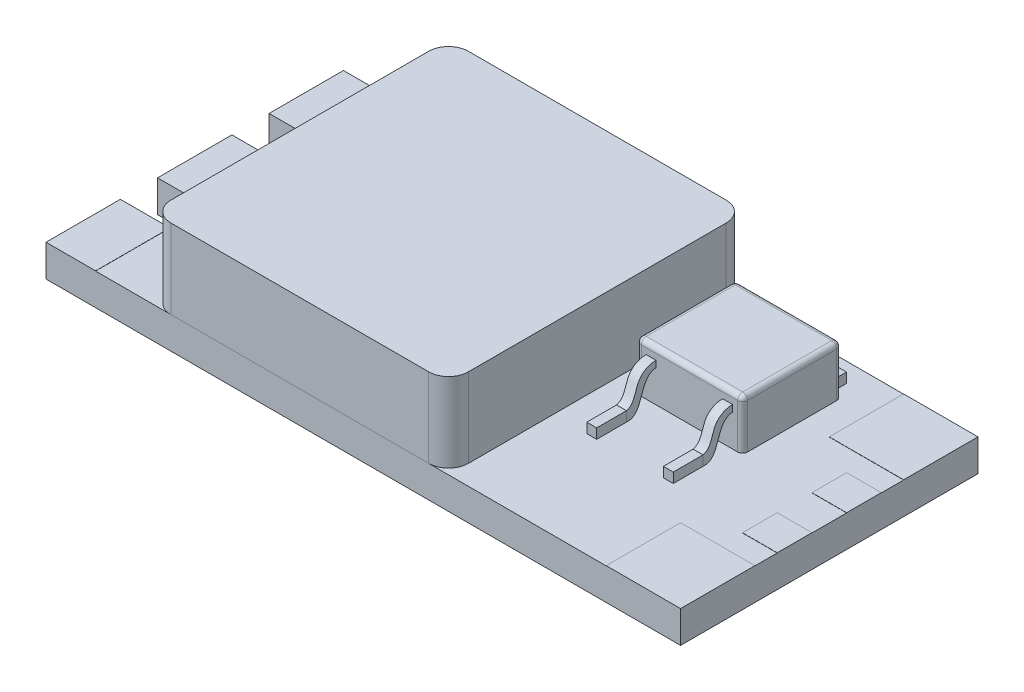
from build123d import *

# Parameters (mm, degrees)
BOSS_EXTRUDE1_DEPTH   = 1.6
SKETCH2_W             = 15
SKETCH2_H             = 15
BOSS_EXTRUDE2_DEPTH   = 4
FILLET1_R             = 1
SKETCH3_W             = 2.5
SKETCH3_H             = 3.75
SKETCH3_W_2           = 3.75
SKETCH3_W_3           = 1.75
SKETCH3_H_2           = 1.75
BOSS_EXTRUDE3_DEPTH   = 0.01
SKETCH4_W             = 5.361600472
SKETCH4_H             = 4.987535322
BOSS_EXTRUDE4_DEPTH   = 2.5
SKETCH6_W             = 4.361600472
SKETCH6_H             = 0.75
BOSS_EXTRUDE5_DEPTH   = 0.5
SKETCH6_W_2           = 0.5
SKETCH6_H_2           = 1.5
BOSS_EXTRUDE5_2_DEPTH = 0.5
BOSS_EXTRUDE5_3_DEPTH = 0.5
BOSS_EXTRUDE6_DEPTH   = 0.5
BOSS_EXTRUDE7_DEPTH   = 0.5
FILLET2_R             = 0.25
FILLET3_R             = 0.25


with BuildPart() as part:
    # Sketch1 → Boss-Extrude1 (new body)
    with BuildSketch(Plane(origin=(0, 0, 0), x_dir=(1, 0, 0), z_dir=(0, 1, 0))):
        Polygon((2.5, 3.75), (0, 3.75), (0, 0), (2.5, 0), (32, 0), (32, 15), (2.5, 15), (0, 15), (0, 11.25), (2.5, 11.25), (2.5, 9.375), (0, 9.375), (0, 5.625), (2.5, 5.625), align=None)
    extrude(amount=BOSS_EXTRUDE1_DEPTH)

    # Sketch3 → Boss-Extrude3 (add)
    with BuildSketch(Plane(origin=(0, 1.6, 0), x_dir=(1, 0, 0), z_dir=(0, 1, 0))):
        with Locations((1.25, 13.125)):
            Rectangle(SKETCH3_W, SKETCH3_H)
        with Locations((30.125, 13.125)):
            Rectangle(SKETCH3_W_2, SKETCH3_H)
        with Locations((1.25, 7.5)):
            Rectangle(SKETCH3_W, SKETCH3_H)
        with Locations((1.25, 1.875)):
            Rectangle(SKETCH3_W, SKETCH3_H)
        with Locations((31.125, 9.25)):
            Rectangle(SKETCH3_W_3, SKETCH3_H_2)
        with Locations((30.125, 1.875)):
            Rectangle(SKETCH3_W_2, SKETCH3_H)
        with Locations((31.125, 5.75)):
            Rectangle(SKETCH3_W_3, SKETCH3_H_2)
    extrude(amount=BOSS_EXTRUDE3_DEPTH)

    # Sketch4 → Boss-Extrude4 (add)
    with BuildSketch(Plane(origin=(0, 1.6, 0), x_dir=(1, 0, 0), z_dir=(0, 1, 0))):
        with Locations((24.163228826, 10.781587961)):
            Rectangle(SKETCH4_W, SKETCH4_H)
    extrude(amount=BOSS_EXTRUDE4_DEPTH)

    # Fillet2
    fillet2_edges = [part.edges().sort_by_distance(p)[0] for p in [
        (21.48242859, 2.85, -13.275355622),
        (21.48242859, 2.85, -8.2878203),
        (26.844029062, 2.85, -8.2878203),
        (26.844029062, 2.85, -13.275355622),
    ]]
    fillet(fillet2_edges, radius=FILLET2_R)

    # Fillet3
    fillet3_edges = [part.edges().sort_by_distance(p)[0] for p in [
        (26.770805757, 4.1, -13.202132318),
        (26.844029062, 4.1, -10.781587961),
        (26.770805757, 4.1, -8.361043604),
        (24.163228826, 4.1, -8.2878203),
        (21.555651895, 4.1, -8.361043604),
        (21.48242859, 4.1, -10.781587961),
        (21.555651895, 4.1, -13.202132318),
        (24.163228826, 4.1, -13.275355622),
    ]]
    fillet(fillet3_edges, radius=FILLET3_R)


with BuildPart() as body_2:
    # Sketch2 → Boss-Extrude2 (new body)
    with BuildSketch(Plane(origin=(0, 1.6, 0), x_dir=(1, 0, 0), z_dir=(0, 1, 0))):
        with Locations((12.8, 7.5)):
            Rectangle(SKETCH2_W, SKETCH2_H)
    extrude(amount=BOSS_EXTRUDE2_DEPTH)

    # Fillet1
    fillet1_edges = [body_2.edges().sort_by_distance(p)[0] for p in [
        (20.3, 3.6, 0),
        (20.3, 3.6, -15),
        (5.3, 3.6, -15),
        (5.3, 3.6, 0),
    ]]
    fillet(fillet1_edges, radius=FILLET1_R)


with BuildPart() as body_3:
    # Sketch6 → Boss-Extrude5 (new body)
    with BuildSketch(Plane(origin=(0, 1.6, 0), x_dir=(1, 0, 0), z_dir=(0, 1, 0))):
        with Locations((24.163228826, 13.650355622)):
            Rectangle(SKETCH6_W, SKETCH6_H)
    extrude(amount=BOSS_EXTRUDE5_DEPTH)


with BuildPart() as body_4:
    # Sketch6 → Boss-Extrude5 2 (new body)
    with BuildSketch(Plane(origin=(0, 1.6, 0), x_dir=(1, 0, 0), z_dir=(0, 1, 0))):
        with Locations((22.23242859, 6.0378203)):
            Rectangle(SKETCH6_W_2, SKETCH6_H_2)
    extrude(amount=BOSS_EXTRUDE5_2_DEPTH)


with BuildPart() as body_5:
    # Sketch6 → Boss-Extrude5 3 (new body)
    with BuildSketch(Plane(origin=(0, 1.6, 0), x_dir=(1, 0, 0), z_dir=(0, 1, 0))):
        with Locations((26.094029062, 6.0378203)):
            Rectangle(SKETCH6_W_2, SKETCH6_H_2)
    extrude(amount=BOSS_EXTRUDE5_3_DEPTH)


with BuildPart() as body_6:
    # Sketch7 → Boss-Extrude6 (new body)
    with BuildSketch(Plane(origin=(26.344029062, 0, 0), x_dir=(0, 0, -1), z_dir=(1, 0, 0))):
        with BuildLine():
            add(Edge.make_bspline(
                [(6.7878203, 1.6), (7.7187684, 1.510074693), (7.374744979, 3.184552482), (8.2878203, 3.226600806)],
                knots=[0, 0, 0, 0, 1, 1, 1, 1], degree=3))
            Line((8.2878203, 3.226600806), (8.2878203, 3.549808919))
            add(Edge.make_bspline(
                [(6.7878203, 2.1), (7.230171652, 2.215377346), (7.192285938, 3.194271107), (7.947516495, 3.566089293), (8.2878203, 3.549808919)],
                knots=[0, 0, 0, 0, 0.555688798, 1, 1, 1, 1], degree=3))
            Line((6.7878203, 2.1), (6.7878203, 1.6))
        make_face()
    extrude(amount=-BOSS_EXTRUDE6_DEPTH)


with BuildPart() as body_7:
    # Sketch8 → Boss-Extrude7 (new body)
    with BuildSketch(Plane(origin=(22.48242859, 0, 0), x_dir=(0, 0, -1), z_dir=(1, 0, 0))):
        with BuildLine():
            Line((6.7878203, 2.1), (6.7878203, 1.6))
            add(Edge.make_bspline(
                [(6.7878203, 1.6), (7.7187684, 1.510074693), (7.374744979, 3.184552482), (8.2878203, 3.226600806)],
                knots=[0, 0, 0, 0, 1, 1, 1, 1], degree=3))
            Line((8.2878203, 3.226600806), (8.2878203, 3.549808919))
            add(Edge.make_bspline(
                [(8.2878203, 3.549808919), (7.947516495, 3.566089293), (7.192285938, 3.194271107), (7.230171652, 2.215377346), (6.7878203, 2.1)],
                knots=[0, 0, 0, 0, 0.444311202, 1, 1, 1, 1], degree=3))
        make_face()
    extrude(amount=-BOSS_EXTRUDE7_DEPTH)


solid = Compound([part.part, body_2.part, body_3.part, body_4.part, body_5.part, body_6.part, body_7.part])
